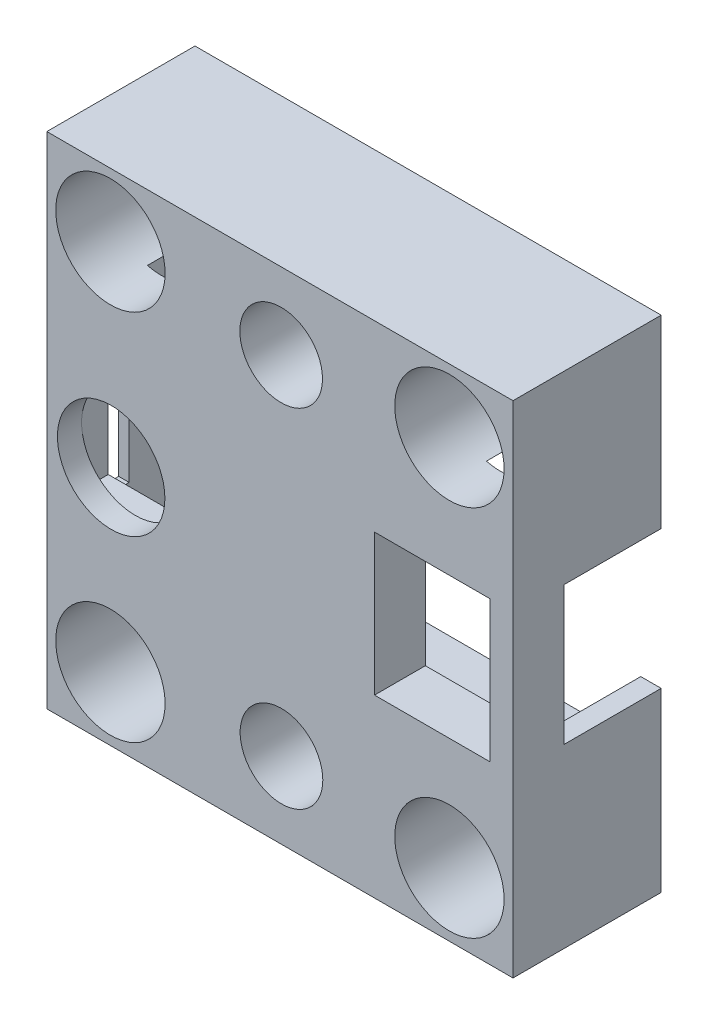
from build123d import *

# Parameters (mm, degrees)
BOSS_EXTRUDE1_OUTLINE_R   = 2.5
BOSS_EXTRUDE1_OUTLINE_R_2 = 1.75
BOSS_EXTRUDE1_DEPTH       = 4.21
BOSS_EXTRUDE2_START       = 4.21
BOSS_EXTRUDE2_OUTLINE_R   = 2.5
BOSS_EXTRUDE2_OUTLINE_R_2 = 1.75
BOSS_EXTRUDE2_DEPTH       = 5.539999985
BOSS_EXTRUDE3_START       = -2.1
SKETCH3_W                 = 36.654989836
SKETCH3_H                 = 39.3126
SKETCH3_R                 = 2.5
SKETCH3_R_2               = 3.25
SKETCH3_W_2               = 9.43005
SKETCH3_H_2               = 9.2
SKETCH3_W_3               = 9.07015
SKETCH3_H_3               = 11.10254
BOSS_EXTRUDE3_DEPTH       = 2.1
CUT_EXTRUDE1_START        = -6
SKETCH3_2_R               = 3.25
SKETCH3_2_R_2             = 1.75
CUT_EXTRUDE1_DEPTH        = 6
SKETCH5_R                 = 4.3
CUT_EXTRUDE2_DEPTH        = 5
CHAMFER1_SIZE             = 3
CUT_EXTRUDE3_REACH        = 44.72
SKETCH6_W                 = 2.25
SKETCH6_H                 = 11.58
BOSS_EXTRUDE5_START       = 1.9
SKETCH7_W                 = 36.654989836
SKETCH7_H                 = 39.3126
SKETCH7_R                 = 4.3
SKETCH7_R_2               = 3.25
SKETCH7_W_2               = 10.43005
SKETCH7_H_2               = 10.2
SKETCH7_W_3               = 9.07015
SKETCH7_H_3               = 11.10254
SKETCH7_W_4               = 9.43005
SKETCH7_H_4               = 9.2
SKETCH7_R_3               = 4.225
BOSS_EXTRUDE5_DEPTH       = 1.9


# Read off the part's stored shape, not the designer's step: Boss-Extrude1, Boss-Extrude2
with BuildPart() as part:
    # Boss-Extrude1 outline → Boss-Extrude1 (new body)
    # profile 1 of 2: a face of its own
    with BuildSketch(Plane.XY):
        Polygon((17.1132, 10.4965), (17.1132, 5.1225), (18.7132, 5.1225), (18.7132, 19.6563), (-17.941789836, 19.6563), (-17.941789836, 4.917774053), (-17.1132, 4.917774053), (-17.1132, 10.4965), align=None)
        with Locations((-12.941789836, 14.6563)):
            Circle(BOSS_EXTRUDE1_OUTLINE_R, mode=Mode.SUBTRACT)
        with Locations((0.4826, 13.6525)):
            Circle(BOSS_EXTRUDE1_OUTLINE_R_2, mode=Mode.SUBTRACT)
        with Locations((13.7132, 14.6563)):
            Circle(BOSS_EXTRUDE1_OUTLINE_R, mode=Mode.SUBTRACT)
    # profile 2 of 2: a face of its own
    with BuildSketch(Plane.XY):
        Polygon((18.7132, -19.6563), (18.7132, -5.7575), (17.109037456, -5.7575), (17.105585288, -10.521897241), (-17.120805727, -10.497097621), (-17.116838767, -5.022225947), (-17.941789836, -5.022225947), (-17.941789836, -19.6563), align=None)
        with Locations((-12.941789836, -14.6563)):
            Circle(BOSS_EXTRUDE1_OUTLINE_R, mode=Mode.SUBTRACT)
        with Locations((0.508, -13.6525)):
            Circle(BOSS_EXTRUDE1_OUTLINE_R_2, mode=Mode.SUBTRACT)
        with Locations((13.7132, -14.6563)):
            Circle(BOSS_EXTRUDE1_OUTLINE_R, mode=Mode.SUBTRACT)
    extrude(amount=BOSS_EXTRUDE1_DEPTH)

    # Boss-Extrude2 outline → Boss-Extrude2 (add)
    with BuildSketch(Plane.XY.offset(BOSS_EXTRUDE2_START)):
        Polygon((17.1132, 10.4965), (17.1132, 5.1225), (18.7132, 5.1225), (18.7132, 19.6563), (-17.941789836, 19.6563), (-17.941789836, -19.6563), (18.7132, -19.6563), (18.7132, -5.7575), (17.109037456, -5.7575), (17.105585288, -10.521897241), (-17.120805727, -10.497097621), (-17.1132, -0.000300188), (-17.1132, 10.4965), align=None)
        with Locations((-12.941789836, -14.6563)):
            Circle(BOSS_EXTRUDE2_OUTLINE_R, mode=Mode.SUBTRACT)
        with Locations((0.508, -13.6525)):
            Circle(BOSS_EXTRUDE2_OUTLINE_R_2, mode=Mode.SUBTRACT)
        with Locations((13.7132, -14.6563)):
            Circle(BOSS_EXTRUDE2_OUTLINE_R, mode=Mode.SUBTRACT)
        with Locations((-12.941789836, 14.6563)):
            Circle(BOSS_EXTRUDE2_OUTLINE_R, mode=Mode.SUBTRACT)
        with Locations((0.4826, 13.6525)):
            Circle(BOSS_EXTRUDE2_OUTLINE_R_2, mode=Mode.SUBTRACT)
        with Locations((13.7132, 14.6563)):
            Circle(BOSS_EXTRUDE2_OUTLINE_R, mode=Mode.SUBTRACT)
    extrude(amount=BOSS_EXTRUDE2_DEPTH)

    # Sketch3 → Boss-Extrude3 (add)
    with BuildSketch(Plane.XY.offset(9.749999985).offset(BOSS_EXTRUDE3_START)):
        with Locations((0.385705082, 0)):
            Rectangle(SKETCH3_W, SKETCH3_H)
        with Locations((-12.941789836, 14.6563)):
            Circle(SKETCH3_R, mode=Mode.SUBTRACT)
        with Locations((13.7132, 14.6563)):
            Circle(SKETCH3_R, mode=Mode.SUBTRACT)
        with Locations((-12.941789836, -14.6563)):
            Circle(SKETCH3_R, mode=Mode.SUBTRACT)
        with Locations((13.7132, -14.6563)):
            Circle(SKETCH3_R, mode=Mode.SUBTRACT)
        with Locations((0.508, -13.6525)):
            Circle(SKETCH3_R_2, mode=Mode.SUBTRACT)
        with Locations((0.4826, 13.6525)):
            Circle(SKETCH3_R_2, mode=Mode.SUBTRACT)
        with Locations((-12.398175, -0.6835)):
            Rectangle(SKETCH3_W_2, SKETCH3_H_2, mode=Mode.SUBTRACT)
        with Locations((12.357075, -0.28623)):
            Rectangle(SKETCH3_W_3, SKETCH3_H_3, mode=Mode.SUBTRACT)
    extrude(amount=BOSS_EXTRUDE3_DEPTH)

    # Sketch3<2> → Cut-Extrude1 (cut)
    # profile 1 of 2: a face of its own
    with BuildSketch(Plane.XY.offset(9.749999985).offset(CUT_EXTRUDE1_START)):
        with Locations((0.4826, 13.6525)):
            Circle(SKETCH3_2_R)
        with Locations((0.4826, 13.6525)):
            Circle(SKETCH3_2_R_2, mode=Mode.SUBTRACT)
    # profile 2 of 2: a face of its own
    with BuildSketch(Plane.XY.offset(9.749999985).offset(CUT_EXTRUDE1_START)):
        with Locations((0.508, -13.6525)):
            Circle(SKETCH3_2_R)
        with Locations((0.508, -13.6525)):
            Circle(SKETCH3_2_R_2, mode=Mode.SUBTRACT)
    extrude(amount=CUT_EXTRUDE1_DEPTH, mode=Mode.SUBTRACT)

    # Sketch5 → Cut-Extrude2 (cut)
    with BuildSketch(Plane.XY.offset(9.749999985)):
        with Locations((-12.941789836, 14.6563)):
            Circle(SKETCH5_R)
        with Locations((13.7132, 14.6563)):
            Circle(SKETCH5_R)
        with Locations((-12.941789836, -14.6563)):
            Circle(SKETCH5_R)
        with Locations((13.7132, -14.6563)):
            Circle(SKETCH5_R)
    extrude(amount=-CUT_EXTRUDE2_DEPTH, mode=Mode.SUBTRACT)

    # Chamfer1
    # the kernel refuses this chamfer: 3 mm, written as the material it takes off along each edge
    with BuildSketch(Plane(origin=(13.7132, 14.6563, 4.749999985), x_dir=(1, 0, 0), z_dir=(0, 1, 0))) as chamfer1_piece_1_section:
        Polygon((2.5 + CHAMFER1_SIZE, 0), (2.5, CHAMFER1_SIZE), (2.5, 0), align=None)
    chamfer1_piece_1 = revolve(axis=Axis((13.7132, 14.6563, 4.749999985), (0, 0, -1)), mode=Mode.PRIVATE)
    chamfer1_piece_1 = chamfer1_piece_1 & Plane(origin=(13.7132, 14.6563, 2.638456685), x_dir=(1, 0, 0), z_dir=(0, 0, 1)) * Cylinder(4.3, 22, mode=Mode.PRIVATE)
    add(chamfer1_piece_1, mode=Mode.SUBTRACT)
    with BuildSketch(Plane(origin=(-12.941789836, -14.6563, 4.749999985), x_dir=(1, 0, 0), z_dir=(0, 1, 0))) as chamfer1_piece_2_section:
        Polygon((2.5 + CHAMFER1_SIZE, 0), (2.5, CHAMFER1_SIZE), (2.5, 0), align=None)
    chamfer1_piece_2 = revolve(axis=Axis((-12.941789836, -14.6563, 4.749999985), (0, 0, -1)), mode=Mode.PRIVATE)
    chamfer1_piece_2 = chamfer1_piece_2 & Plane(origin=(-12.941789836, -14.6563, 2.638456685), x_dir=(1, 0, 0), z_dir=(0, 0, 1)) * Cylinder(4.3, 22, mode=Mode.PRIVATE)
    add(chamfer1_piece_2, mode=Mode.SUBTRACT)
    with BuildSketch(Plane(origin=(13.7132, -14.6563, 4.749999985), x_dir=(1, 0, 0), z_dir=(0, 1, 0))) as chamfer1_piece_3_section:
        Polygon((2.5 + CHAMFER1_SIZE, 0), (2.5, CHAMFER1_SIZE), (2.5, 0), align=None)
    chamfer1_piece_3 = revolve(axis=Axis((13.7132, -14.6563, 4.749999985), (0, 0, -1)), mode=Mode.PRIVATE)
    chamfer1_piece_3 = chamfer1_piece_3 & Plane(origin=(13.7132, -14.6563, 2.638456685), x_dir=(1, 0, 0), z_dir=(0, 0, 1)) * Cylinder(4.3, 22, mode=Mode.PRIVATE)
    add(chamfer1_piece_3, mode=Mode.SUBTRACT)
    with BuildSketch(Plane(origin=(-12.941789836, 14.6563, 4.749999985), x_dir=(1, 0, 0), z_dir=(0, 1, 0))) as chamfer1_piece_4_section:
        Polygon((2.5 + CHAMFER1_SIZE, 0), (2.5, CHAMFER1_SIZE), (2.5, 0), align=None)
    chamfer1_piece_4 = revolve(axis=Axis((-12.941789836, 14.6563, 4.749999985), (0, 0, -1)), mode=Mode.PRIVATE)
    chamfer1_piece_4 = chamfer1_piece_4 & Plane(origin=(-12.941789836, 14.6563, 2.638456685), x_dir=(1, 0, 0), z_dir=(0, 0, 1)) * Cylinder(4.3, 22, mode=Mode.PRIVATE)
    add(chamfer1_piece_4, mode=Mode.SUBTRACT)

    # Cut-Extrude3: up to this face of the body (flat: up to its plane)
    cut_extrude3_end = Plane(part.part.faces().sort_by_distance((-17.118822247, -7.759661784, 2.105))[0])
    # Sketch6 → Cut-Extrude3 (cut, up to the picked face)
    with BuildSketch(Plane.ZY.offset(17.941789836), mode=Mode.PRIVATE) as cut_extrude3_sk1:
        with Locations((7.124999985, -0.86020819)):
            Rectangle(SKETCH6_W, SKETCH6_H)
    cut_extrude3_tool1 = split(extrude(cut_extrude3_sk1.sketch, amount=-CUT_EXTRUDE3_REACH, mode=Mode.PRIVATE), bisect_by=cut_extrude3_end, keep=Keep.BOTH, mode=Mode.PRIVATE)
    add(cut_extrude3_tool1.solids().sort_by(Axis((-17.94179, -0.860208, 7.125), (1, 0, 0)))[0], mode=Mode.SUBTRACT)

    # Sketch7 → Boss-Extrude5 (add)
    # profile 1 of 3: a face of its own
    with BuildSketch(Plane.XY.offset(9.749999985).offset(BOSS_EXTRUDE5_START)):
        with Locations((0.385705082, 0)):
            Rectangle(SKETCH7_W, SKETCH7_H)
        with Locations((13.7132, 14.6563)):
            Circle(SKETCH7_R, mode=Mode.SUBTRACT)
        with Locations((13.7132, -14.6563)):
            Circle(SKETCH7_R, mode=Mode.SUBTRACT)
        with Locations((0.4826, 13.6525)):
            Circle(SKETCH7_R_2, mode=Mode.SUBTRACT)
        with Locations((0.508, -13.6525)):
            Circle(SKETCH7_R_2, mode=Mode.SUBTRACT)
        with Locations((-12.941789836, 14.6563)):
            Circle(SKETCH7_R, mode=Mode.SUBTRACT)
        with Locations((-12.941789836, -14.6563)):
            Circle(SKETCH7_R, mode=Mode.SUBTRACT)
        with Locations((-12.398175, -0.6835)):
            Rectangle(SKETCH7_W_2, SKETCH7_H_2, mode=Mode.SUBTRACT)
        with Locations((12.357075, -0.28623)):
            Rectangle(SKETCH7_W_3, SKETCH7_H_3, mode=Mode.SUBTRACT)
    # profile 2 of 3: a face of its own
    with BuildSketch(Plane.XY.offset(9.749999985).offset(BOSS_EXTRUDE5_START)):
        with Locations((-12.398175, -0.6835)):
            Rectangle(SKETCH7_W_2, SKETCH7_H_2)
        with Locations((-12.398175, -0.6835)):
            Rectangle(SKETCH7_W_4, SKETCH7_H_4, mode=Mode.SUBTRACT)
    # profile 3 of 3: a face of its own
    with BuildSketch(Plane.XY.offset(9.749999985).offset(BOSS_EXTRUDE5_START)):
        with Locations((-12.398175, -0.6835)):
            Rectangle(SKETCH7_W_4, SKETCH7_H_4)
        with Locations((-12.88315, -0.6835)):
            Circle(SKETCH7_R_3, mode=Mode.SUBTRACT)
    extrude(amount=-BOSS_EXTRUDE5_DEPTH)


solid = part.part
